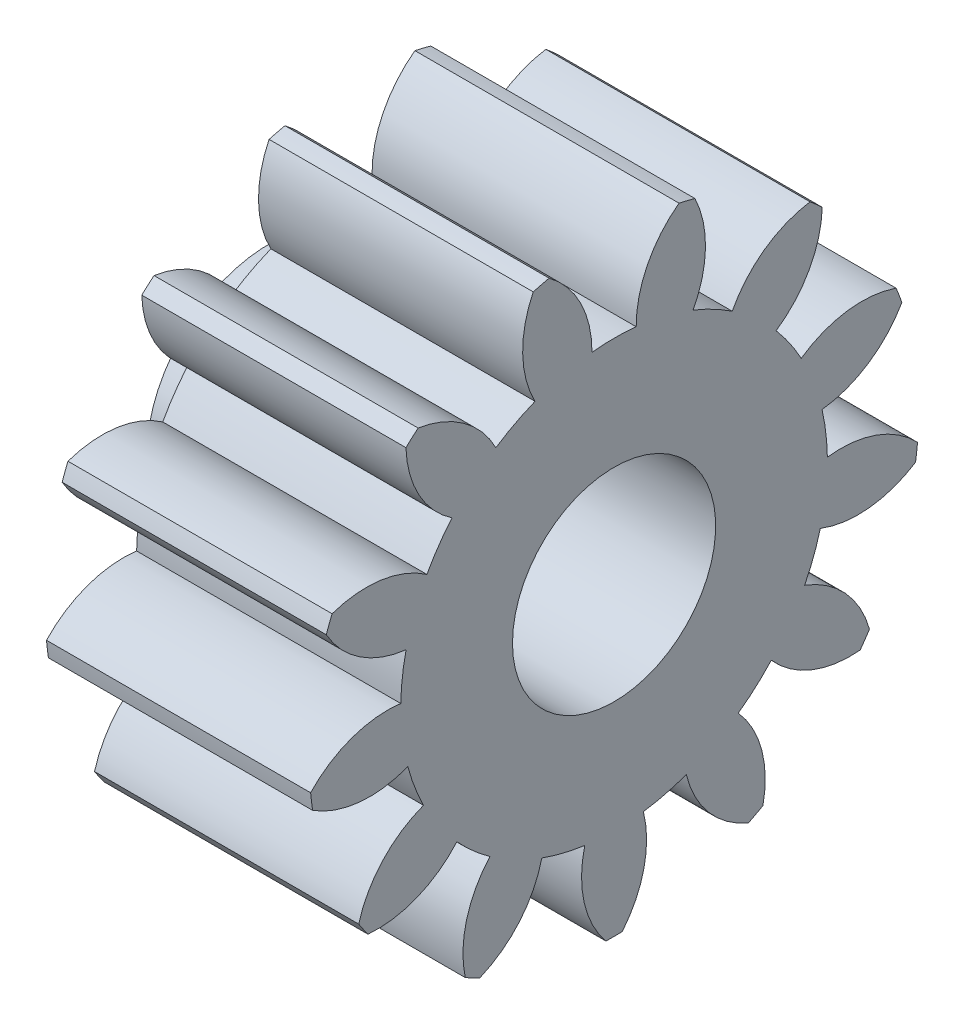
from build123d import *

# Parameters (mm, degrees)
BASPROSKE_W      = 13
BASPROSKE_H      = 15
TOOTHCUT_DEPTH   = 25.879710609
TEETHCUTS_COUNT  = 13
TEETHCUTS_ANGLE  = 332.307692308
HUBNEAONESKE_R   = 6
HUBNEARONE_DEPTH = 4.0000508
BORSKE_R         = 5
BORE_DEPTH       = 17.0000508
SCALE1_SCALE     = 0.317565217


with BuildPart() as part:
    # BasProSke → Base-Revolve (revolve)
    with BuildSketch(Plane(origin=(0, 0, 0), x_dir=(1, 0, 0), z_dir=(0, 1, 0))):
        with Locations((6.5, 7.5)):
            Rectangle(BASPROSKE_W, BASPROSKE_H)
    revolve(axis=Axis((-10, 0, 0), (1, 0, 0)))

    # TooCutSke → ToothCut (cut, through all)
    with BuildSketch(Plane(origin=(0, 0, 0), x_dir=(0, 0, -1), z_dir=(1, 0, 0))):
        with BuildLine():
            ThreePointArc((1.088245291, 10.442448141), (0, 10.499), (-1.088245291, 10.442448141))
            ThreePointArc((-1.088245291, 10.442448141), (-1.646045958, 12.816546547), (-3.224884568, 14.675243258))
            ThreePointArc((-3.224884568, 14.675243258), (0, 15.0254), (3.224884568, 14.675243258))
            ThreePointArc((3.224884568, 14.675243258), (1.646045958, 12.816546547), (1.088245291, 10.442448141))
        make_face()
    toothcut = extrude(amount=TOOTHCUT_DEPTH, mode=Mode.SUBTRACT)

    # TeethCuts: ToothCut ×13 about axis
    teethcuts_axis = Axis((-10, 0, 0), (1, 0, 0))
    for i in range(1, TEETHCUTS_COUNT):
        add(toothcut.rotate(teethcuts_axis, i * TEETHCUTS_ANGLE / (TEETHCUTS_COUNT - 1)), mode=Mode.SUBTRACT)

    # HubNeaOneSke → HubNearOne (add)
    with BuildSketch(Plane.ZY):
        Circle(HUBNEAONESKE_R)
    extrude(amount=HUBNEARONE_DEPTH)

    # BorSke → Bore (cut, symmetric)
    with BuildSketch(Plane(origin=(0, 0, 0), x_dir=(0, 0, -1), z_dir=(1, 0, 0))):
        Circle(BORSKE_R)
    extrude(amount=BORE_DEPTH, both=True, mode=Mode.SUBTRACT)


with BuildPart() as part_1:
    # Scale1: scaled about (6.291140597, 0, 0)
    add(part.part.scale(SCALE1_SCALE).moved(Location((4.293293168, 0, 0))))


solid = part_1.part
